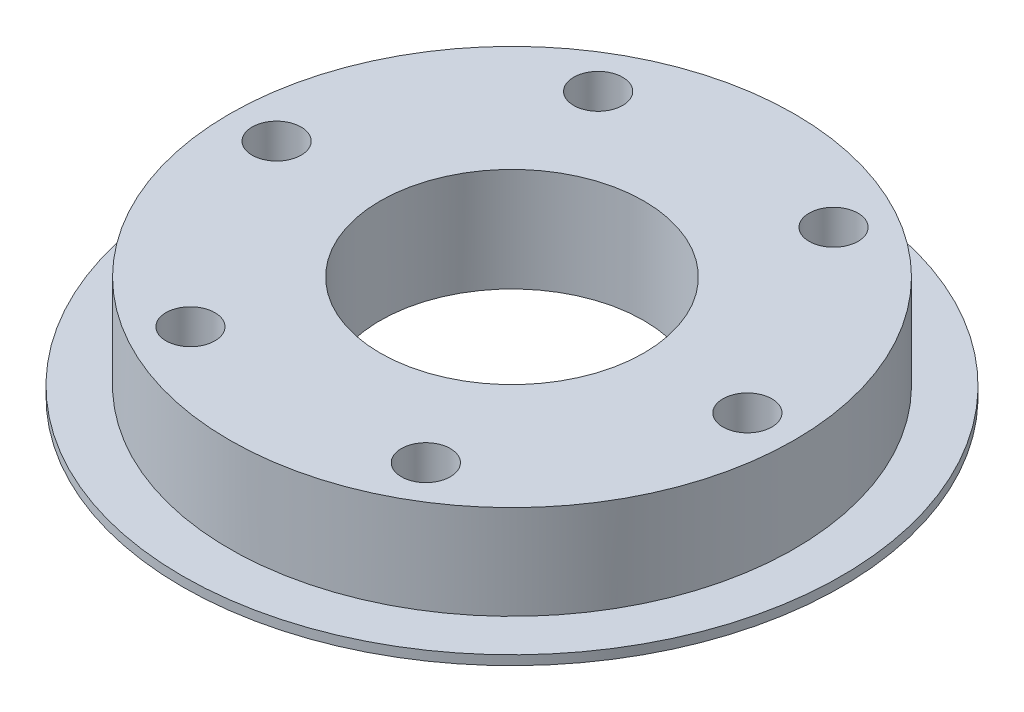
from build123d import *

# Parameters (mm, degrees)
SKETCH1_R           = 30
BOSS_EXTRUDE1_DEPTH = 11
SKETCH2_R           = 35
BOSS_EXTRUDE2_DEPTH = 1
SKETCH3_R           = 1.75
CUT_EXTRUDE1_DEPTH  = 4
SKETCH4_R           = 14
CUT_EXTRUDE2_DEPTH  = 51
SKETCH5_R           = 2.6
CUT_EXTRUDE3_DEPTH  = 25


with BuildPart() as part:
    # Sketch1 → Boss-Extrude1 (new body)
    with BuildSketch(Plane(origin=(0, 0, 0), x_dir=(1, 0, 0), z_dir=(0, 1, 0))):
        Circle(SKETCH1_R)
    extrude(amount=BOSS_EXTRUDE1_DEPTH)

    # Sketch2 → Boss-Extrude2 (add)
    with BuildSketch(Plane.XZ):
        Circle(SKETCH2_R)
    extrude(amount=-BOSS_EXTRUDE2_DEPTH)

    # Sketch3 → Cut-Extrude1 (cut)
    with BuildSketch(Plane(origin=(0, 0, 0), x_dir=(1, 0, 0), z_dir=(0, 1, 0))):
        with Locations((0, 25)):
            Circle(SKETCH3_R)
        with Locations((21.650635095, 12.5)):
            Circle(SKETCH3_R)
        with Locations((21.650635095, -12.5)):
            Circle(SKETCH3_R)
        with Locations((0, -25)):
            Circle(SKETCH3_R)
        with Locations((-21.650635095, -12.5)):
            Circle(SKETCH3_R)
        with Locations((-21.650635095, 12.5)):
            Circle(SKETCH3_R)
    extrude(amount=CUT_EXTRUDE1_DEPTH, mode=Mode.SUBTRACT)

    # Sketch4 → Cut-Extrude2 (cut)
    with BuildSketch(Plane.XZ):
        Circle(SKETCH4_R)
    extrude(amount=-CUT_EXTRUDE2_DEPTH, mode=Mode.SUBTRACT)

    # Sketch5 → Cut-Extrude3 (cut)
    with BuildSketch(Plane.XZ):
        with Locations((-12.5, 21.650635095)):
            Circle(SKETCH5_R)
        with Locations((12.5, 21.650635095)):
            Circle(SKETCH5_R)
        with Locations((25, 0)):
            Circle(SKETCH5_R)
        with Locations((12.5, -21.650635095)):
            Circle(SKETCH5_R)
        with Locations((-12.5, -21.650635095)):
            Circle(SKETCH5_R)
        with Locations((-25, 0)):
            Circle(SKETCH5_R)
    extrude(amount=-CUT_EXTRUDE3_DEPTH, mode=Mode.SUBTRACT)


solid = part.part
